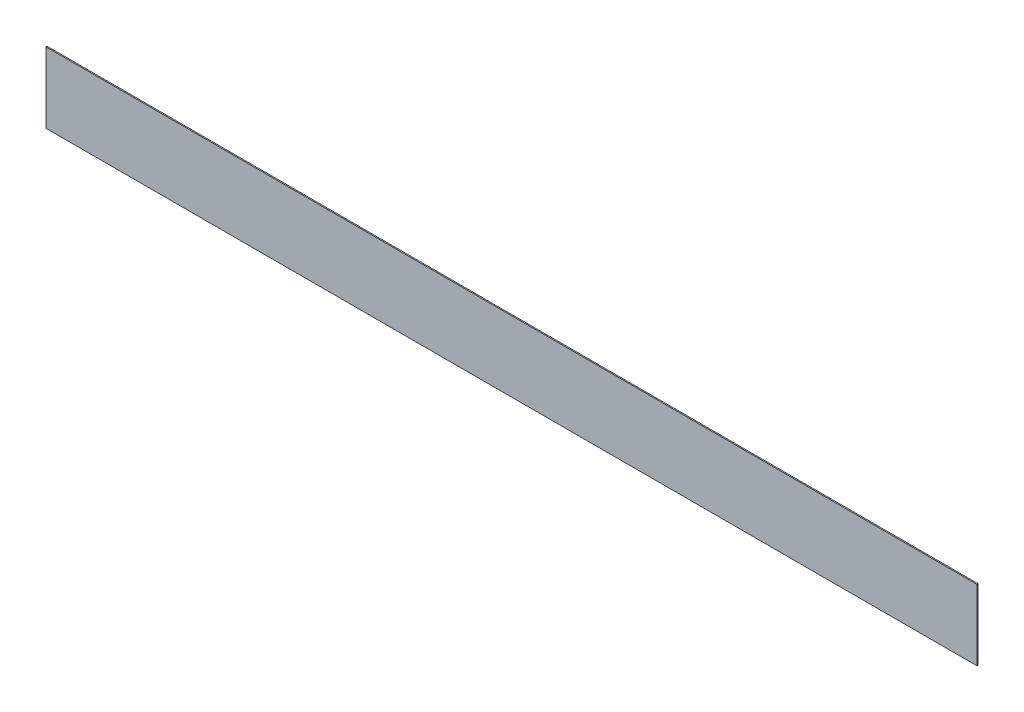
from build123d import *

# Parameters (mm, degrees)
SKETCH_7_W             = 3300
SKETCH_7_H             = 4
SM_BASE_FLANGE_2_DEPTH = 250


# Sheet-metal steps are written as plain solids
with BuildPart() as part:
    # 草图7 → 基体-法兰2 (new body)
    with BuildSketch(Plane(origin=(0, -495, 0), x_dir=(1, 0, 0), z_dir=(0, 1, 0))):
        with Locations((0, -1752)):
            Rectangle(SKETCH_7_W, SKETCH_7_H)
    extrude(amount=-SM_BASE_FLANGE_2_DEPTH)


solid = part.part
